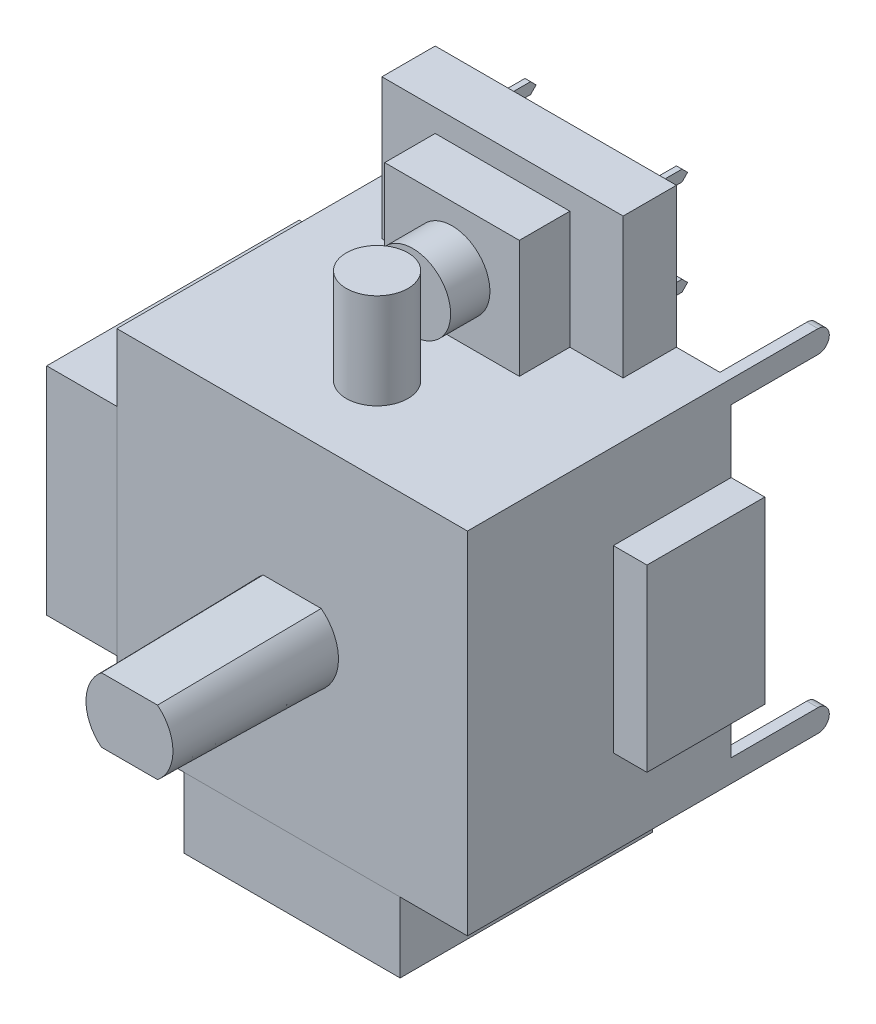
from build123d import *

# Parameters (mm, degrees)
SKETCH1_W              = 15.875
SKETCH1_H              = 15.875
BOSS_EXTRUDE1_DEPTH    = 11.938
SKETCH2_W              = 10.922
SKETCH2_H              = 6.35
BOSS_EXTRUDE2_DEPTH    = 2.413
SKETCH3_W              = 5.334
SKETCH3_H              = 8.128
BOSS_EXTRUDE3_DEPTH    = 1.524
SKETCH4_W              = 6.096
SKETCH4_H              = 5.334
BOSS_EXTRUDE4_DEPTH    = 2.286
SKETCH5_R              = 1.7145
BOSS_EXTRUDE5_DEPTH    = 1.778
SKETCH6_R              = 1.397
BOSS_EXTRUDE6_DEPTH    = 4.318
SKETCH7_W              = 9.779
SKETCH7_H              = 11.43
BOSS_EXTRUDE7_DEPTH    = 3.175
SKETCH8_W              = 11.43
SKETCH8_H              = 9.779
BOSS_EXTRUDE8_DEPTH    = 3.175
SKETCH9_R              = 2.413
SKETCH9_R_2            = 1.8415
CUT_EXTRUDE1_DEPTH     = 0.508
SKETCH10_R             = 2.413
SKETCH10_R_2           = 1.8415
CUT_EXTRUDE2_DEPTH     = 0.508
SKETCH12_W             = 0.508
SKETCH12_H             = 4.445
EXTRUDE_THIN1_DEPTH    = 1.016
SKETCH13_W             = 0.508
SKETCH13_H             = 4.445
EXTRUDE_THIN2_DEPTH    = 1.016
FILLET1_R              = 0.508
BOSS_EXTRUDE9_DEPTH    = 0.254
BOSS_EXTRUDE9_2_DEPTH  = 0.254
BOSS_EXTRUDE9_3_DEPTH  = 0.254
BOSS_EXTRUDE10_DEPTH   = 0.254
BOSS_EXTRUDE10_2_DEPTH = 0.254
BOSS_EXTRUDE10_3_DEPTH = 0.254
SKETCH16_W             = 0.254
SKETCH16_H             = 0.508
BOSS_EXTRUDE11_DEPTH   = 2.54
CHAMFER1_SIZE          = 0.254
BOSS_EXTRUDE12_DEPTH   = 7.366
DRAFT1_ANGLE           = 1


with BuildPart() as part:
    # Sketch1 → Boss-Extrude1 (new body)
    with BuildSketch(Plane.XY):
        with Locations((7.9375, 7.9375)):
            Rectangle(SKETCH1_W, SKETCH1_H)
    extrude(amount=BOSS_EXTRUDE1_DEPTH)

    # Sketch2 → Boss-Extrude2 (add)
    with BuildSketch(Plane(origin=(0, 0, 0), x_dir=(-1, 0, 0), z_dir=(0, 0, -1))):
        with Locations((-7.9375, 19.05)):
            Rectangle(SKETCH2_W, SKETCH2_H)
    extrude(amount=-BOSS_EXTRUDE2_DEPTH)

    # Sketch3 → Boss-Extrude3 (add)
    with BuildSketch(Plane(origin=(15.875, 0, 0), x_dir=(0, 0, -1), z_dir=(1, 0, 0))):
        with Locations((-2.667, 7.9375)):
            Rectangle(SKETCH3_W, SKETCH3_H)
    extrude(amount=BOSS_EXTRUDE3_DEPTH)

    # Sketch4 → Boss-Extrude4 (add)
    with BuildSketch(Plane.XY.offset(2.413)):
        with Locations((7.9375, 18.542)):
            Rectangle(SKETCH4_W, SKETCH4_H)
    extrude(amount=BOSS_EXTRUDE4_DEPTH)

    # Sketch5 → Boss-Extrude5 (add)
    with BuildSketch(Plane.XY.offset(4.699)):
        with Locations(Location((7.9375, 18.542, 0), (0, 0, 180))):
            Circle(SKETCH5_R)
    extrude(amount=BOSS_EXTRUDE5_DEPTH)

    # Sketch6 → Boss-Extrude6 (add)
    with BuildSketch(Plane(origin=(0, 15.875, 0), x_dir=(1, 0, 0), z_dir=(0, 1, 0))):
        with Locations(Location((7.9375, -8.090189982, 0), (0, 0, 90))):
            Circle(SKETCH6_R)
    extrude(amount=BOSS_EXTRUDE6_DEPTH)

    # Sketch12 → Extrude-Thin1 (add)
    with BuildSketch(Plane.XZ):
        with Locations((0.254, -2.2225)):
            Rectangle(SKETCH12_W, SKETCH12_H)
        with Locations((15.621, -2.2225)):
            Rectangle(SKETCH12_W, SKETCH12_H)
    extrude(amount=-EXTRUDE_THIN1_DEPTH)

    # Sketch13 → Extrude-Thin2 (add)
    with BuildSketch(Plane(origin=(0, 15.875, 0), x_dir=(1, 0, 0), z_dir=(0, 1, 0))):
        with Locations((0.254, 2.2225)):
            Rectangle(SKETCH13_W, SKETCH13_H)
        with Locations((15.621, 2.2225)):
            Rectangle(SKETCH13_W, SKETCH13_H)
    extrude(amount=-EXTRUDE_THIN2_DEPTH)

    # Fillet1
    fillet1_edges = [part.edges().sort_by_distance(p)[0] for p in [
        (0.254, 1.016, -4.445),
        (0.254, 15.875, -4.445),
        (0.254, 14.859, -4.445),
        (15.621, 15.875, -4.445),
        (15.621, 14.859, -4.445),
        (15.621, 1.016, -4.445),
        (15.621, 0, -4.445),
        (0.254, 0, -4.445),
    ]]
    fillet(fillet1_edges, radius=FILLET1_R - 0.0001)  # a hair under: the kernel refuses the full size

    # Sketch16 → Boss-Extrude11 (add)
    with BuildSketch(Plane(origin=(0, 0, 0), x_dir=(-1, 0, 0), z_dir=(0, 0, -1))):
        with Locations((-11.2395, 20.447)):
            Rectangle(SKETCH16_W, SKETCH16_H)
        with Locations((-4.3815, 20.447)):
            Rectangle(SKETCH16_W, SKETCH16_H)
        with Locations((-4.3815, 16.129)):
            Rectangle(SKETCH16_W, SKETCH16_H)
        with Locations((-11.2395, 16.129)):
            Rectangle(SKETCH16_W, SKETCH16_H)
    extrude(amount=BOSS_EXTRUDE11_DEPTH)

    # Chamfer1
    chamfer1_edges = [part.edges().sort_by_distance(p)[0] for p in [
        (11.2395, 15.875, -2.54),
        (11.2395, 16.383, -2.54),
        (4.3815, 15.875, -2.54),
        (4.3815, 16.383, -2.54),
        (4.3815, 20.193, -2.54),
        (4.3815, 20.701, -2.54),
        (11.2395, 20.193, -2.54),
        (11.2395, 20.701, -2.54),
    ]]
    chamfer(chamfer1_edges, length=CHAMFER1_SIZE - 0.0001)  # a hair under: the kernel refuses the full size

    # Sketch17 → Boss-Extrude12 (add)
    with BuildSketch(Plane.XY.offset(11.938)):
        with BuildLine():
            Line((6.6675, 9.398), (9.2075, 9.398))
            ThreePointArc((9.2075, 9.398), (9.906, 7.9375), (9.2075, 6.477))
            Line((9.2075, 6.477), (6.6675, 6.477))
            ThreePointArc((6.6675, 6.477), (5.969, 7.9375), (6.6675, 9.398))
        make_face()
    extrude(amount=BOSS_EXTRUDE12_DEPTH)

    # Draft1
    draft1_faces = [part.faces().sort_by_distance(p)[0] for p in [
        (9.906, 7.9375, 15.621),
        (7.9375, 9.398, 15.621),
        (5.969, 7.9375, 15.621),
        (7.9375, 6.477, 15.621),
    ]]
    draft(draft1_faces, Plane(origin=(7.845136364, 7.9375, 19.304), x_dir=(1, 0, 0), z_dir=(0, 0, 1)), DRAFT1_ANGLE)


with BuildPart() as body_2:
    # Sketch7 → Boss-Extrude7 (new body)
    with BuildSketch(Plane.XZ):
        with Locations((7.9375, 6.223)):
            Rectangle(SKETCH7_W, SKETCH7_H)
    extrude(amount=BOSS_EXTRUDE7_DEPTH)

    # Sketch10 → Cut-Extrude2 (cut)
    # profile 1 of 5: a face of its own
    with BuildSketch(Plane.XZ.offset(3.175)):
        with Locations(Location((7.9375, 6.858, 0), (0, 0, 270))):
            Circle(SKETCH10_R)
        with Locations(Location((7.9375, 6.858, 0), (0, 0, 270))):
            Circle(SKETCH10_R_2, mode=Mode.SUBTRACT)
    # profile 2 of 5: a face of its own
    with BuildSketch(Plane.XZ.offset(3.175)):
        with BuildLine():
            Line((3.429447205, 7.62), (4.98628669, 7.62))
            ThreePointArc((4.98628669, 7.62), (5.782238531, 9.013261469), (7.1755, 9.80921331))
            Line((7.1755, 9.80921331), (7.1755, 11.366052795))
            ThreePointArc((7.1755, 11.366052795), (4.704607796, 10.090892204), (3.429447205, 7.62))
        make_face()
    # profile 3 of 5: a face of its own
    with BuildSketch(Plane.XZ.offset(3.175)):
        with BuildLine():
            Line((3.429447205, 6.096), (4.98628669, 6.096))
            ThreePointArc((4.98628669, 6.096), (5.782238531, 4.702738531), (7.1755, 3.90678669))
            Line((7.1755, 3.90678669), (7.1755, 2.349947205))
            ThreePointArc((7.1755, 2.349947205), (4.704607796, 3.625107796), (3.429447205, 6.096))
        make_face()
    # profile 4 of 5: a face of its own
    with BuildSketch(Plane.XZ.offset(3.175)):
        with BuildLine():
            Line((8.6995, 11.366052795), (8.6995, 9.80921331))
            ThreePointArc((8.6995, 9.80921331), (10.092761469, 9.013261469), (10.88871331, 7.62))
            Line((10.88871331, 7.62), (12.445552795, 7.62))
            ThreePointArc((12.445552795, 7.62), (11.170392204, 10.090892204), (8.6995, 11.366052795))
        make_face()
    # profile 5 of 5: a face of its own
    with BuildSketch(Plane.XZ.offset(3.175)):
        with BuildLine():
            Line((12.445552795, 6.096), (10.88871331, 6.096))
            ThreePointArc((10.88871331, 6.096), (10.092761469, 4.702738531), (8.6995, 3.90678669))
            Line((8.6995, 3.90678669), (8.6995, 2.349947205))
            ThreePointArc((8.6995, 2.349947205), (11.170392204, 3.625107796), (12.445552795, 6.096))
        make_face()
    extrude(amount=-CUT_EXTRUDE2_DEPTH, mode=Mode.SUBTRACT)


with BuildPart() as body_3:
    # Sketch8 → Boss-Extrude8 (new body)
    with BuildSketch(Plane.ZY):
        with Locations((6.223, 7.9375)):
            Rectangle(SKETCH8_W, SKETCH8_H)
    extrude(amount=BOSS_EXTRUDE8_DEPTH)

    # Sketch9 → Cut-Extrude1 (cut)
    # profile 1 of 5: a face of its own
    with BuildSketch(Plane.ZY.offset(3.175)):
        with Locations((6.858, 7.9375)):
            Circle(SKETCH9_R)
        with Locations((6.858, 7.9375)):
            Circle(SKETCH9_R_2, mode=Mode.SUBTRACT)
    # profile 2 of 5: a face of its own
    with BuildSketch(Plane.ZY.offset(3.175)):
        with BuildLine():
            Line((7.62, 12.445552795), (7.62, 10.88871331))
            ThreePointArc((7.62, 10.88871331), (9.013261469, 10.092761469), (9.80921331, 8.6995))
            Line((9.80921331, 8.6995), (11.366052795, 8.6995))
            ThreePointArc((11.366052795, 8.6995), (10.090892204, 11.170392204), (7.62, 12.445552795))
        make_face()
    # profile 3 of 5: a face of its own
    with BuildSketch(Plane.ZY.offset(3.175)):
        with BuildLine():
            Line((6.096, 12.445552795), (6.096, 10.88871331))
            ThreePointArc((6.096, 10.88871331), (4.702738531, 10.092761469), (3.90678669, 8.6995))
            Line((3.90678669, 8.6995), (2.349947205, 8.6995))
            ThreePointArc((2.349947205, 8.6995), (3.625107796, 11.170392204), (6.096, 12.445552795))
        make_face()
    # profile 4 of 5: a face of its own
    with BuildSketch(Plane.ZY.offset(3.175)):
        with BuildLine():
            Line((11.366052795, 7.1755), (9.80921331, 7.1755))
            ThreePointArc((9.80921331, 7.1755), (9.013261469, 5.782238531), (7.62, 4.98628669))
            Line((7.62, 4.98628669), (7.62, 3.429447205))
            ThreePointArc((7.62, 3.429447205), (10.090892204, 4.704607796), (11.366052795, 7.1755))
        make_face()
    # profile 5 of 5: a face of its own
    with BuildSketch(Plane.ZY.offset(3.175)):
        with BuildLine():
            Line((6.096, 3.429447205), (6.096, 4.98628669))
            ThreePointArc((6.096, 4.98628669), (4.702738531, 5.782238531), (3.90678669, 7.1755))
            Line((3.90678669, 7.1755), (2.349947205, 7.1755))
            ThreePointArc((2.349947205, 7.1755), (3.625107796, 4.704607796), (6.096, 3.429447205))
        make_face()
    extrude(amount=-CUT_EXTRUDE1_DEPTH, mode=Mode.SUBTRACT)


with BuildPart() as body_4:
    # Sketch14 → Boss-Extrude9 (new, symmetric)
    with BuildSketch(Plane(origin=(0, -1.5875, 0), x_dir=(-1, 0, 0), z_dir=(0, -1, 0))):
        Polygon((-10.0965, -0.508), (-10.0965, 3.697342898), (-10.4775, 4.298407671), (-10.8585, 3.697342898), (-10.8585, -0.508), align=None)
    extrude(amount=BOSS_EXTRUDE9_DEPTH, both=True)


with BuildPart() as body_5:
    # Sketch14 → Boss-Extrude9 2 (new, symmetric)
    with BuildSketch(Plane(origin=(0, -1.5875, 0), x_dir=(-1, 0, 0), z_dir=(0, -1, 0))):
        Polygon((-7.5565, -0.508), (-7.5565, 3.697342898), (-7.9375, 4.298407671), (-8.3185, 3.697342898), (-8.3185, -0.508), align=None)
    extrude(amount=BOSS_EXTRUDE9_2_DEPTH, both=True)


with BuildPart() as body_6:
    # Sketch14 → Boss-Extrude9 3 (new, symmetric)
    with BuildSketch(Plane(origin=(0, -1.5875, 0), x_dir=(-1, 0, 0), z_dir=(0, -1, 0))):
        Polygon((-5.0165, -0.508), (-5.0165, 3.697342898), (-5.3975, 4.298407671), (-5.7785, 3.697342898), (-5.7785, -0.508), align=None)
    extrude(amount=BOSS_EXTRUDE9_3_DEPTH, both=True)


with BuildPart() as body_7:
    # Sketch15 → Boss-Extrude10 (new, symmetric)
    with BuildSketch(Plane.ZY.offset(1.5875)):
        Polygon((0.508, 8.3185), (-3.697342898, 8.3185), (-4.298407671, 7.9375), (-3.697342898, 7.5565), (0.508, 7.5565), align=None)
    extrude(amount=BOSS_EXTRUDE10_DEPTH, both=True)


with BuildPart() as body_8:
    # Sketch15 → Boss-Extrude10 2 (new, symmetric)
    with BuildSketch(Plane.ZY.offset(1.5875)):
        Polygon((0.508, 5.7785), (-3.697342898, 5.7785), (-4.298407671, 5.3975), (-3.697342898, 5.0165), (0.508, 5.0165), align=None)
    extrude(amount=BOSS_EXTRUDE10_2_DEPTH, both=True)


with BuildPart() as body_9:
    # Sketch15 → Boss-Extrude10 3 (new, symmetric)
    with BuildSketch(Plane.ZY.offset(1.5875)):
        Polygon((0.508, 10.8585), (-3.697342898, 10.8585), (-4.298407671, 10.4775), (-3.697342898, 10.0965), (0.508, 10.0965), align=None)
    extrude(amount=BOSS_EXTRUDE10_3_DEPTH, both=True)


solid = Compound([part.part, body_2.part, body_3.part, body_4.part, body_5.part, body_6.part, body_7.part, body_8.part, body_9.part])
